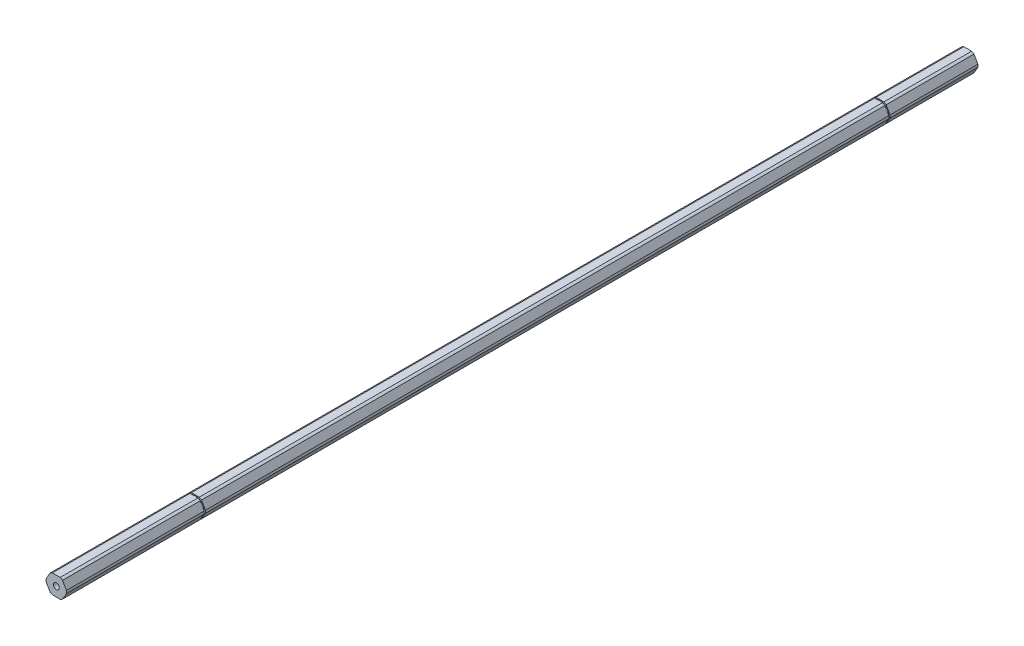
from build123d import *

# Parameters (mm, degrees)
SKETCH1_R           = 2.000000064
BOSS_EXTRUDE1_DEPTH = 609.6
SKETCH2_W           = 1.651
SKETCH2_H           = 0.889


with BuildPart() as part:
    # Sketch1 → Boss-Extrude1 (new body)
    with BuildSketch(Plane.XY):
        with BuildLine():
            ThreePointArc((4.181770846, 5.456960429), (3.437499983, 5.953924622), (2.634980936, 6.35))
            Line((2.634980936, 6.35), (-2.634980936, 6.35))
            ThreePointArc((-2.634980936, 6.35), (-3.437499983, 5.953924622), (-4.181770846, 5.456960429))
            Line((-4.181770846, 5.456960429), (-6.816751782, 0.893039571))
            ThreePointArc((-6.816751782, 0.893039571), (-6.874999966, 0), (-6.816751782, -0.893039571))
            Line((-6.816751782, -0.893039571), (-4.181770846, -5.456960429))
            ThreePointArc((-4.181770846, -5.456960429), (-3.437499983, -5.953924622), (-2.634980936, -6.35))
            Line((-2.634980936, -6.35), (2.634980936, -6.35))
            ThreePointArc((2.634980936, -6.35), (3.437499983, -5.953924622), (4.181770846, -5.456960429))
            Line((4.181770846, -5.456960429), (6.816751782, -0.893039571))
            ThreePointArc((6.816751782, -0.893039571), (6.860422465, -0.447468582), (6.874999966, 0))
            ThreePointArc((6.874999966, 0), (6.860422465, 0.447468582), (6.816751782, 0.893039571))
            Line((6.816751782, 0.893039571), (4.181770846, 5.456960429))
        make_face()
        Circle(SKETCH1_R, mode=Mode.SUBTRACT)
    extrude(amount=BOSS_EXTRUDE1_DEPTH)

    # Sketch2 → Cut-Revolve1 (revolve, cut)
    with BuildSketch(Plane(origin=(0, 0, 0), x_dir=(1, 0, 0), z_dir=(0, 1, 0))):
        with Locations((6.6802, -517.0805)):
            Rectangle(SKETCH2_W, SKETCH2_H)
        with Locations((6.6802, -59.182)):
            Rectangle(SKETCH2_W, SKETCH2_H)
    revolve(axis=Axis((0, 0, 609.6), (0, 0, -1)), mode=Mode.SUBTRACT)


solid = part.part
